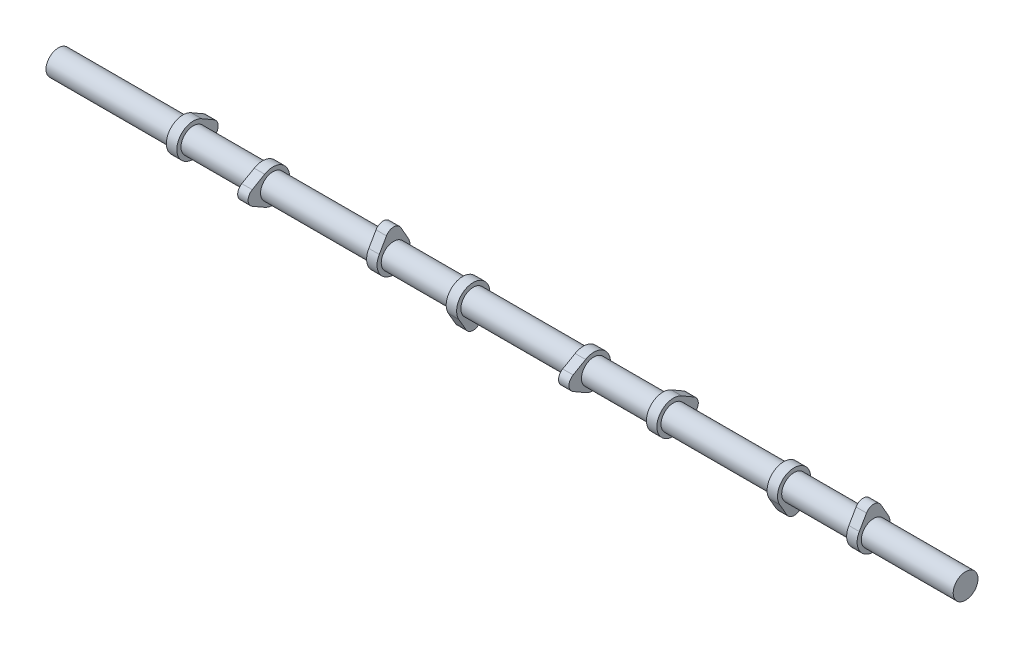
from build123d import *

# Parameters (mm, degrees)
BOSS_EXTRUDE1_DEPTH         = 4
BODY_MOVE_COPY2_ANGLE       = 180
SKETCH2_R                   = 9.5
BOSS_EXTRUDE2_DEPTH         = 153.4
BODY_MOVE_COPY3_START       = -613.6
BODY_MOVE_COPY3_OUTLINE_R   = 9.5
BODY_MOVE_COPY3_DEPTH       = 157.4
BODY_MOVE_COPY3_START_2     = -525.16
BODY_MOVE_COPY3_2_OUTLINE_R = 9.5
BODY_MOVE_COPY3_2_DEPTH     = 8
BODY_MOVE_COPY3_START_3     = -464.2
BODY_MOVE_COPY3_3_OUTLINE_R = 9.5
BODY_MOVE_COPY3_3_DEPTH     = 8
BODY_MOVE_COPY3_START_4     = -460.2
BODY_MOVE_COPY3_4_OUTLINE_R = 9.5
BODY_MOVE_COPY3_4_DEPTH     = 157.4
BODY_MOVE_COPY3_START_5     = -371.76
BODY_MOVE_COPY3_5_OUTLINE_R = 9.5
BODY_MOVE_COPY3_5_DEPTH     = 8
BODY_MOVE_COPY3_START_6     = -310.8
BODY_MOVE_COPY3_6_OUTLINE_R = 9.5
BODY_MOVE_COPY3_6_DEPTH     = 8
BODY_MOVE_COPY3_START_7     = -306.8
BODY_MOVE_COPY3_7_OUTLINE_R = 9.5
BODY_MOVE_COPY3_7_DEPTH     = 157.4
BODY_MOVE_COPY3_START_8     = -218.36
BODY_MOVE_COPY3_8_OUTLINE_R = 9.5
BODY_MOVE_COPY3_8_DEPTH     = 8
BODY_MOVE_COPY3_START_9     = -157.4
BODY_MOVE_COPY3_9_OUTLINE_R = 9.5
BODY_MOVE_COPY3_9_DEPTH     = 8
BODY_MOVE_COPY4_ANGLE       = 90
BODY_MOVE_COPY5_ANGLE       = 180
BODY_MOVE_COPY6_ANGLE       = 90
BOSS_EXTRUDE3_START         = 74.42
SKETCH2_2_R                 = 9.5
BOSS_EXTRUDE3_DEPTH         = 74.42
BOSS_EXTRUDE4_START         = -620.58
SKETCH2_3_R                 = 9.5
BOSS_EXTRUDE4_DEPTH         = 6.98


# Read off the part's stored shape, not the designer's step: Body-Move/Copy3
with BuildPart() as part:
    # Sketch1 → Boss-Extrude1 (new, symmetric)
    with BuildSketch(Plane(origin=(0, 0, 0), x_dir=(0, 0, -1), z_dir=(1, 0, 0))):
        with BuildLine():
            Line((5.499261314, 15.875), (10.998522628, 6.35))
            ThreePointArc((10.998522628, 6.35), (0, -12.7), (-10.998522628, 6.35))
            Line((-10.998522628, 6.35), (-5.499261314, 15.875))
            ThreePointArc((-5.499261314, 15.875), (0, 19.05), (5.499261314, 15.875))
        make_face()
    extrude(amount=BOSS_EXTRUDE1_DEPTH, both=True)


with BuildPart() as body_2:
    # Body-Move/Copy1: copy of part
    add(part.part.moved(Location((-60.96, 0, 0))))


with BuildPart() as body_2_1:
    # Body-Move/Copy2: moved
    add(body_2.part.rotate(Axis((0, 0, 0), (1, 0, 0)), BODY_MOVE_COPY2_ANGLE))


with BuildPart() as part_1:
    add(part.part)

    add(body_2_1.part)  # Boss-Extrude2 merges body 2
    # Sketch2 → Boss-Extrude2 (add)
    with BuildSketch(Plane(origin=(0, 0, 0), x_dir=(0, 0, -1), z_dir=(1, 0, 0))):
        Circle(SKETCH2_R)
    extrude(amount=-BOSS_EXTRUDE2_DEPTH)

    # Sketch2<2> → Boss-Extrude3 (add)
    with BuildSketch(Plane(origin=(0, 0, 0), x_dir=(0, 0, -1), z_dir=(1, 0, 0)).offset(BOSS_EXTRUDE3_START)):
        with Locations(Location((0, 0, 0), (0, 0, 180))):
            Circle(SKETCH2_2_R)
    extrude(amount=-BOSS_EXTRUDE3_DEPTH)


with BuildPart() as body_2_2:
    # Body-Move/Copy3 outline → Body-Move/Copy3 (new body)
    with BuildSketch(Plane.YZ.offset(BODY_MOVE_COPY3_START)):
        Circle(BODY_MOVE_COPY3_OUTLINE_R)
    extrude(amount=BODY_MOVE_COPY3_DEPTH)

    # Body-Move_Copy3 2 outline → Body-Move_Copy3 2 (add)
    with BuildSketch(Plane.YZ.offset(BODY_MOVE_COPY3_START_2)):
        with BuildLine():
            ThreePointArc((6.35, -10.998522628), (12.7, 0), (6.35, 10.998522628))
            ThreePointArc((6.35, 10.998522628), (0, 12.7), (-6.35, 10.998522628))
            Line((-6.35, 10.998522628), (-15.875, 5.499261314))
            ThreePointArc((-15.875, 5.499261314), (-19.05, 0), (-15.875, -5.499261314))
            Line((-15.875, -5.499261314), (-6.35, -10.998522628))
            ThreePointArc((-6.35, -10.998522628), (0, -12.7), (6.35, -10.998522628))
        make_face()
        Circle(BODY_MOVE_COPY3_2_OUTLINE_R, mode=Mode.SUBTRACT)
    extrude(amount=BODY_MOVE_COPY3_2_DEPTH)

    # Body-Move_Copy3 3 outline → Body-Move_Copy3 3 (add)
    with BuildSketch(Plane.YZ.offset(BODY_MOVE_COPY3_START_3)):
        with BuildLine():
            ThreePointArc((15.875, -5.499261314), (19.05, 0), (15.875, 5.499261314))
            Line((15.875, 5.499261314), (6.35, 10.998522628))
            ThreePointArc((6.35, 10.998522628), (-12.7, 0), (6.35, -10.998522628))
            Line((6.35, -10.998522628), (15.875, -5.499261314))
        make_face()
        Circle(BODY_MOVE_COPY3_3_OUTLINE_R, mode=Mode.SUBTRACT)
    extrude(amount=BODY_MOVE_COPY3_3_DEPTH)


with BuildPart() as body_3:
    # Body-Move_Copy3 4 outline → Body-Move_Copy3 4 (new body)
    with BuildSketch(Plane.YZ.offset(BODY_MOVE_COPY3_START_4)):
        Circle(BODY_MOVE_COPY3_4_OUTLINE_R)
    extrude(amount=BODY_MOVE_COPY3_4_DEPTH)

    # Body-Move_Copy3 5 outline → Body-Move_Copy3 5 (add)
    with BuildSketch(Plane.YZ.offset(BODY_MOVE_COPY3_START_5)):
        with BuildLine():
            ThreePointArc((6.35, -10.998522628), (12.7, 0), (6.35, 10.998522628))
            ThreePointArc((6.35, 10.998522628), (0, 12.7), (-6.35, 10.998522628))
            Line((-6.35, 10.998522628), (-15.875, 5.499261314))
            ThreePointArc((-15.875, 5.499261314), (-19.05, 0), (-15.875, -5.499261314))
            Line((-15.875, -5.499261314), (-6.35, -10.998522628))
            ThreePointArc((-6.35, -10.998522628), (0, -12.7), (6.35, -10.998522628))
        make_face()
        Circle(BODY_MOVE_COPY3_5_OUTLINE_R, mode=Mode.SUBTRACT)
    extrude(amount=BODY_MOVE_COPY3_5_DEPTH)

    # Body-Move_Copy3 6 outline → Body-Move_Copy3 6 (add)
    with BuildSketch(Plane.YZ.offset(BODY_MOVE_COPY3_START_6)):
        with BuildLine():
            ThreePointArc((15.875, -5.499261314), (19.05, 0), (15.875, 5.499261314))
            Line((15.875, 5.499261314), (6.35, 10.998522628))
            ThreePointArc((6.35, 10.998522628), (-12.7, 0), (6.35, -10.998522628))
            Line((6.35, -10.998522628), (15.875, -5.499261314))
        make_face()
        Circle(BODY_MOVE_COPY3_6_OUTLINE_R, mode=Mode.SUBTRACT)
    extrude(amount=BODY_MOVE_COPY3_6_DEPTH)


with BuildPart() as body_4:
    # Body-Move_Copy3 7 outline → Body-Move_Copy3 7 (new body)
    with BuildSketch(Plane.YZ.offset(BODY_MOVE_COPY3_START_7)):
        Circle(BODY_MOVE_COPY3_7_OUTLINE_R)
    extrude(amount=BODY_MOVE_COPY3_7_DEPTH)

    # Body-Move_Copy3 8 outline → Body-Move_Copy3 8 (add)
    with BuildSketch(Plane.YZ.offset(BODY_MOVE_COPY3_START_8)):
        with BuildLine():
            ThreePointArc((6.35, -10.998522628), (12.7, 0), (6.35, 10.998522628))
            ThreePointArc((6.35, 10.998522628), (0, 12.7), (-6.35, 10.998522628))
            Line((-6.35, 10.998522628), (-15.875, 5.499261314))
            ThreePointArc((-15.875, 5.499261314), (-19.05, 0), (-15.875, -5.499261314))
            Line((-15.875, -5.499261314), (-6.35, -10.998522628))
            ThreePointArc((-6.35, -10.998522628), (0, -12.7), (6.35, -10.998522628))
        make_face()
        Circle(BODY_MOVE_COPY3_8_OUTLINE_R, mode=Mode.SUBTRACT)
    extrude(amount=BODY_MOVE_COPY3_8_DEPTH)

    # Body-Move_Copy3 9 outline → Body-Move_Copy3 9 (add)
    with BuildSketch(Plane.YZ.offset(BODY_MOVE_COPY3_START_9)):
        with BuildLine():
            ThreePointArc((15.875, -5.499261314), (19.05, 0), (15.875, 5.499261314))
            Line((15.875, 5.499261314), (6.35, 10.998522628))
            ThreePointArc((6.35, 10.998522628), (-12.7, 0), (6.35, -10.998522628))
            Line((6.35, -10.998522628), (15.875, -5.499261314))
        make_face()
        Circle(BODY_MOVE_COPY3_9_OUTLINE_R, mode=Mode.SUBTRACT)
    extrude(amount=BODY_MOVE_COPY3_9_DEPTH)


with BuildPart() as body_4_1:
    # Body-Move/Copy4: moved
    add(body_4.part.rotate(Axis((0, 0, 0), (-1, 0, 0)), BODY_MOVE_COPY4_ANGLE))


with BuildPart() as body_3_1:
    # Body-Move/Copy5: moved
    add(body_3.part.rotate(Axis((0, 0, 0), (1, 0, 0)), BODY_MOVE_COPY5_ANGLE))


with BuildPart() as body_2_2_1:
    # Body-Move/Copy6: moved
    add(body_2_2.part.rotate(Axis((0, 0, 0), (1, 0, 0)), BODY_MOVE_COPY6_ANGLE))

    # Combine1: union part, body 4, body 3
    add(part_1.part)
    add(body_4_1.part)
    add(body_3_1.part)

    # Sketch2<3> → Boss-Extrude4 (add)
    with BuildSketch(Plane(origin=(0, 0, 0), x_dir=(0, 0, -1), z_dir=(1, 0, 0)).offset(BOSS_EXTRUDE4_START)):
        with Locations(Location((0, 0, 0), (0, 0, 90))):
            Circle(SKETCH2_3_R)
    extrude(amount=BOSS_EXTRUDE4_DEPTH)


solid = body_2_2_1.part
